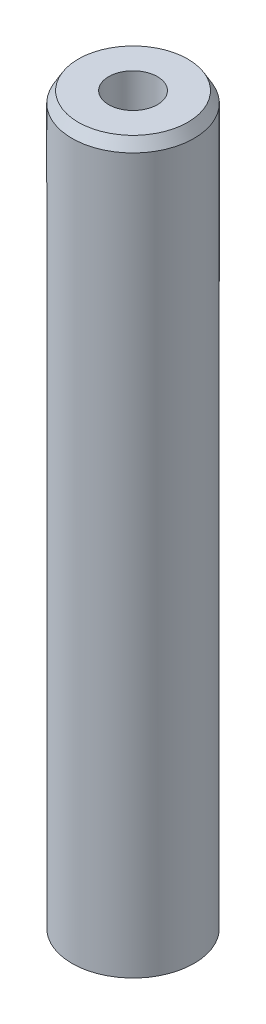
from build123d import *
from OCP.BRepFilletAPI import BRepFilletAPI_MakeChamfer

# Parameters (mm, degrees)
SKETCH1_R           = 30
BOSS_EXTRUDE1_DEPTH = 359.631004556
SKETCH2_R           = 11.97212594
CUT_EXTRUDE1_DEPTH  = 363.124922421
CHAMFER1_SIZE       = 5.331162293
CHAMFER1_SIZE2      = 3.077947985


with BuildPart() as part:
    # Sketch1 → Boss-Extrude1 (new body)
    with BuildSketch(Plane(origin=(0, 0, 0), x_dir=(1, 0, 0), z_dir=(0, 1, 0))):
        Circle(SKETCH1_R)
    extrude(amount=BOSS_EXTRUDE1_DEPTH)

    # Sketch2 → Cut-Extrude1 (cut, through all)
    with BuildSketch(Plane(origin=(0, 0, 0), x_dir=(1, 0, 0), z_dir=(0, 1, 0))):
        Circle(SKETCH2_R)
    extrude(amount=CUT_EXTRUDE1_DEPTH, mode=Mode.SUBTRACT)

    # Chamfer1: one chamfer whose edges measure the first distance from different faces: ONE call of the kernel's chamfer builder (chamfer() names one face for all edges)
    chamfer1_edges_1 = [part.edges().sort_by_distance(p)[0] for p in [
        (-30, 359.631004556, 0),
    ]]
    chamfer1_side_1 = [part.faces().sort_by_distance(p)[0] for p in [
        (-30, 179.815502278, 0),
    ]]
    chamfer1_edges_2 = [part.edges().sort_by_distance(p)[0] for p in [
        (-30, 0, 0),
    ]]
    chamfer1_side_2 = [part.faces().sort_by_distance(p)[0] for p in [
        (-29.151471863, 0, 0),
    ]]
    chamfer1 = BRepFilletAPI_MakeChamfer(part.part.solid().wrapped)
    for e in chamfer1_edges_1:
        chamfer1.Add(CHAMFER1_SIZE, CHAMFER1_SIZE2, e.wrapped, chamfer1_side_1[0].wrapped)  # the first distance lies on this face
    for e in chamfer1_edges_2:
        chamfer1.Add(CHAMFER1_SIZE, CHAMFER1_SIZE2, e.wrapped, chamfer1_side_2[0].wrapped)  # the first distance lies on this face
    add(Compound.cast(chamfer1.Shape()), mode=Mode.REPLACE)


solid = part.part
